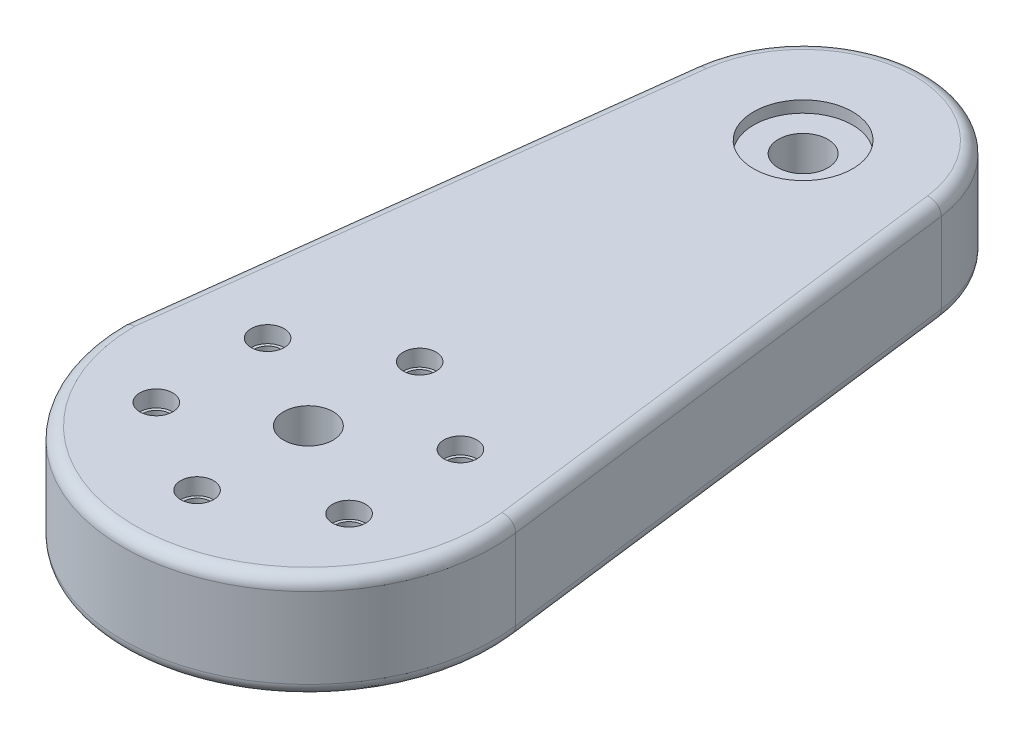
from build123d import *
from OCP.BRepAlgoAPI import BRepAlgoAPI_Cut
from OCP.TopTools import TopTools_ListOfShape

# Parameters (mm, degrees)
EXTRUDE_1_DEPTH                = 4.25
HOLE_WIZARD_M2_1_D             = 1.6
FILLET_1_R                     = 1
SKETCH_5_R                     = 2
CUT_EXTRUDE_1_DEPTH            = 53.889034825
SKETCH_6_R                     = 3
CUT_EXTRUDE_2_DEPTH            = 53.889034825
SCALE_1_SCALE                  = 1.5
SKETCH_7_R                     = 2
CUT_EXTRUDE_3_DEPTH            = 2
PATTERN_START                  = 4.374998274
PATTERN_CIRCULAR_1_OUTLINE_R   = 2
PATTERN_CIRCULAR_1_OUTLINE_R_2 = 1.2
PATTERN_CIRCULAR_1_DEPTH       = 2
SKETCH_10_R                    = 1.65
CUT_EXTRUDE_4_DEPTH            = 10
PATTERN_START_2                = -5.625001726
PATTERN_CIRCULAR_2_OUTLINE_R   = 1.65
PATTERN_CIRCULAR_2_OUTLINE_R_2 = 1.2
PATTERN_CIRCULAR_2_DEPTH       = 10
SKETCH_11_R                    = 1.2
EXTRUDE_2_DEPTH                = 0.75
PATTERN_START_3                = -6.375001726
PATTERN_CIRCULAR_3_OUTLINE_R   = 1.2
PATTERN_CIRCULAR_3_DEPTH       = 0.75
SKETCH_12_R                    = 4.5
SKETCH_12_R_2                  = 3
EXTRUDE_3_DEPTH                = 12.75
CUT_EXTRUDE_START              = -12.75
SKETCH_14_R                    = 6
CUT_EXTRUDE_6_DEPTH            = 1.4


with BuildPart() as part:
    # 草图1 → 凸台-拉伸1 (new, symmetric)
    with BuildSketch(Plane(origin=(0, 0, 0), x_dir=(1, 0, 0), z_dir=(0, 1, 0))):
        with BuildLine():
            ThreePointArc((9.921567416, 41.25), (-0.014158448, 49.999989977), (-9.925067247, 41.221900218))
            Line((-9.925067247, 41.221900218), (-14.552087957, 3.638232549))
            Line((-14.552087957, 3.638232549), (-15, 0))
            ThreePointArc((-15, 0), (0.939343688, -14.970558889), (14.882351125, 1.875))
            Line((14.882351125, 1.875), (9.921567416, 41.25))
        make_face()
    extrude(amount=EXTRUDE_1_DEPTH, both=True)

    # M2 螺纹孔1 (through all)
    with Locations(Plane(origin=(0, 4.25, 0), x_dir=(1, 0, 0), z_dir=(0, 1, 0))):
        with Locations((0, 9), (7.794228634, 4.5), (7.794228634, -4.5), (0, -9), (-7.794228634, -4.5), (-7.794228634, 4.5)):
            Hole(HOLE_WIZARD_M2_1_D / 2)

    # 圆角1
    # the kernel refuses this fillet: 1 mm, written as the material it takes off along each edge
    with BuildSketch(Plane(origin=(0, 4.25, -40), x_dir=(0.9921567416492214, 0, -0.1250000000000007), z_dir=(0.1250000000000007, 0, 0.9921567416492214))) as fillet_1_piece_1:
        with BuildLine():
            CenterArc((10 - FILLET_1_R, -FILLET_1_R), FILLET_1_R, 0, 90)
            Line((10 - FILLET_1_R, 0), (10, 0))
            Line((10, 0), (10, -FILLET_1_R))
        make_face()
    revolve(axis=Axis((0, 4.25, -40), (0, 1, 0)), revolution_arc=165.800732353, mode=Mode.SUBTRACT)
    with BuildSketch(Plane(origin=(-15.519307592, 4.25, 4.21815358), x_dir=(0.9925067247033508, 0, 0.1221900217637565), z_dir=(0.12219002176375648, 0, -0.9925067247033507))) as fillet_1_piece_2:
        with BuildLine():
            CenterArc((FILLET_1_R, FILLET_1_R), FILLET_1_R, 180, 90)
            Line((0, FILLET_1_R), (0, 0))
            Line((0, 0), (FILLET_1_R, 0))
        make_face()
    extrude(amount=45.783119315, mode=Mode.SUBTRACT)
    with BuildSketch(Plane(origin=(0, 4.25, 0), x_dir=(-0.9860951018491775, 0, -0.16618197889380262), z_dir=(0.16618197889380262, 0, -0.9860951018491775))) as fillet_1_piece_3:
        with BuildLine():
            CenterArc((15 - FILLET_1_R, -FILLET_1_R), FILLET_1_R, 0, 90)
            Line((15, -FILLET_1_R), (15, 0))
            Line((15, 0), (15 - FILLET_1_R, 0))
        make_face()
    revolve(axis=Axis((0, 4.25, 0), (0, 1, 0)), revolution_arc=196.746660685, mode=Mode.SUBTRACT)
    with BuildSketch(Plane(origin=(0, -4.25, 0), x_dir=(-0.9860951018491775, 0, -0.16618197889380262), z_dir=(0.16618197889380262, 0, -0.9860951018491775))) as fillet_1_piece_4:
        with BuildLine():
            CenterArc((15 - FILLET_1_R, FILLET_1_R), FILLET_1_R, 270, 90)
            Line((15, FILLET_1_R), (15, 0))
            Line((15, 0), (15 - FILLET_1_R, 0))
        make_face()
    revolve(axis=Axis((0, -4.25, 0), (0, 1, 0)), revolution_arc=196.746660685, mode=Mode.SUBTRACT)
    with BuildSketch(Plane(origin=(14.882351125, 4.25, -1.875), x_dir=(0, -1, 0), z_dir=(-0.12499999999999992, 0, -0.9921567416492215))) as fillet_1_piece_5:
        with BuildLine():
            CenterArc((FILLET_1_R, FILLET_1_R), FILLET_1_R, 180, 90)
            Line((0, FILLET_1_R), (0, 0))
            Line((0, 0), (FILLET_1_R, 0))
        make_face()
    extrude(amount=39.686269666, mode=Mode.SUBTRACT)
    with BuildSketch(Plane(origin=(-15.519307592, -4.25, 4.21815358), x_dir=(0.9925067247033508, 0, 0.1221900217637565), z_dir=(0.12219002176375648, 0, -0.9925067247033507))) as fillet_1_piece_6:
        with BuildLine():
            CenterArc((FILLET_1_R, -FILLET_1_R), FILLET_1_R, 90, 90)
            Line((0, -FILLET_1_R), (0, 0))
            Line((0, 0), (FILLET_1_R, 0))
        make_face()
    extrude(amount=45.783119315, mode=Mode.SUBTRACT)
    with BuildSketch(Plane(origin=(0, -4.25, -40), x_dir=(0.9921567416492214, 0, -0.1250000000000007), z_dir=(0.1250000000000007, 0, 0.9921567416492214))) as fillet_1_piece_7:
        with BuildLine():
            CenterArc((10 - FILLET_1_R, FILLET_1_R), FILLET_1_R, 270, 90)
            Line((10, FILLET_1_R), (10, 0))
            Line((10, 0), (10 - FILLET_1_R, 0))
        make_face()
    revolve(axis=Axis((0, -4.25, -40), (0, 1, 0)), revolution_arc=165.800732353, mode=Mode.SUBTRACT)
    with BuildSketch(Plane(origin=(14.882351125, -4.25, -1.875), x_dir=(0, 1, 0), z_dir=(-0.12499999999999992, 0, -0.9921567416492215))) as fillet_1_piece_8:
        with BuildLine():
            CenterArc((FILLET_1_R, -FILLET_1_R), FILLET_1_R, 90, 90)
            Line((0, -FILLET_1_R), (0, 0))
            Line((0, 0), (FILLET_1_R, 0))
        make_face()
    extrude(amount=39.686269666, mode=Mode.SUBTRACT)

    # 草图5 → 切除-拉伸1 (cut, through all)
    with BuildSketch(Plane(origin=(0, 4.25, 0), x_dir=(1, 0, 0), z_dir=(0, 1, 0))):
        with Locations(Location((0, 40, 0), (0, 0, 270))):
            Circle(SKETCH_5_R)
    extrude(amount=-CUT_EXTRUDE_1_DEPTH, mode=Mode.SUBTRACT)

    # 草图6 → 切除-拉伸2 (cut, through all)
    with BuildSketch(Plane(origin=(0, 4.25, 0), x_dir=(1, 0, 0), z_dir=(0, 1, 0))):
        with Locations(Location((0, 0, 0), (0, 0, 270))):
            Circle(SKETCH_6_R)
    extrude(amount=-CUT_EXTRUDE_2_DEPTH, mode=Mode.SUBTRACT)


with BuildPart() as part_1:
    # 缩放比例1: scaled about (0.021575212, 0, -15.703057272)
    add(part.part.scale(SCALE_1_SCALE).moved(Location((-0.010787606, 0, 7.851528636))))


with BuildPart() as cut_extrude_3_tool:
    # 草图7 → 切除-拉伸3 (new body)
    with BuildSketch(Plane(origin=(0, 6.374998274, 0), x_dir=(1, 0, 0), z_dir=(0, 1, 0))):
        with Locations(Location((-0.010790425, 5.648473397, 0), (0, 0, 270))):
            Circle(SKETCH_7_R)
    extrude(amount=-CUT_EXTRUDE_3_DEPTH)


with BuildPart() as part_2:
    add(part_1.part)

    # 切除-拉伸3: cut by cut_extrude_3_tool, with a tolerance
    cut_extrude_3_stock = TopTools_ListOfShape()
    cut_extrude_3_stock.Append(part_2.part.wrapped)
    cut_extrude_3_tools = TopTools_ListOfShape()
    cut_extrude_3_tools.Append(cut_extrude_3_tool.part.wrapped)
    cut_extrude_3_cut = BRepAlgoAPI_Cut()
    cut_extrude_3_cut.SetArguments(cut_extrude_3_stock)
    cut_extrude_3_cut.SetTools(cut_extrude_3_tools)
    cut_extrude_3_cut.SetFuzzyValue(0.00001)
    cut_extrude_3_cut.Build()
    add(Compound.cast(cut_extrude_3_cut.Shape()).solids(), mode=Mode.REPLACE)


with BuildPart() as pattern_circular_1_tool:
    # 阵列(圆周)1: read off the stored shape, not the designer's step
    # 阵列(圆周)1 outline → 阵列(圆周)1 (new body)
    # profile 1 of 5: a face of its own
    with BuildSketch(Plane(origin=(0, 0, 0), x_dir=(1, 0, 0), z_dir=(0, 1, 0)).offset(PATTERN_START)):
        with Locations((11.680552526, -1.101526603)):
            Circle(PATTERN_CIRCULAR_1_OUTLINE_R)
        with Locations((11.680552526, -1.101526603)):
            Circle(PATTERN_CIRCULAR_1_OUTLINE_R_2, mode=Mode.SUBTRACT)
    # profile 2 of 5: a face of its own
    with BuildSketch(Plane(origin=(0, 0, 0), x_dir=(1, 0, 0), z_dir=(0, 1, 0)).offset(PATTERN_START)):
        with Locations((11.680552526, -14.601526603)):
            Circle(PATTERN_CIRCULAR_1_OUTLINE_R)
        with Locations((11.680552526, -14.601526603)):
            Circle(PATTERN_CIRCULAR_1_OUTLINE_R_2, mode=Mode.SUBTRACT)
    # profile 3 of 5: a face of its own
    with BuildSketch(Plane(origin=(0, 0, 0), x_dir=(1, 0, 0), z_dir=(0, 1, 0)).offset(PATTERN_START)):
        with Locations((-0.010790425, -21.351526603)):
            Circle(PATTERN_CIRCULAR_1_OUTLINE_R)
        with Locations((-0.010790425, -21.351526603)):
            Circle(PATTERN_CIRCULAR_1_OUTLINE_R_2, mode=Mode.SUBTRACT)
    # profile 4 of 5: a face of its own
    with BuildSketch(Plane(origin=(0, 0, 0), x_dir=(1, 0, 0), z_dir=(0, 1, 0)).offset(PATTERN_START)):
        with Locations((-11.702133376, -14.601526603)):
            Circle(PATTERN_CIRCULAR_1_OUTLINE_R)
        with Locations((-11.702133376, -14.601526603)):
            Circle(PATTERN_CIRCULAR_1_OUTLINE_R_2, mode=Mode.SUBTRACT)
    # profile 5 of 5: a face of its own
    with BuildSketch(Plane(origin=(0, 0, 0), x_dir=(1, 0, 0), z_dir=(0, 1, 0)).offset(PATTERN_START)):
        with Locations((-11.702133376, -1.101526603)):
            Circle(PATTERN_CIRCULAR_1_OUTLINE_R)
        with Locations((-11.702133376, -1.101526603)):
            Circle(PATTERN_CIRCULAR_1_OUTLINE_R_2, mode=Mode.SUBTRACT)
    extrude(amount=PATTERN_CIRCULAR_1_DEPTH)


with BuildPart() as part_3:
    add(part_2.part)

    # 阵列(圆周)1: cut by pattern_circular_1_tool, with a tolerance
    pattern_circular_1_stock = TopTools_ListOfShape()
    pattern_circular_1_stock.Append(part_3.part.wrapped)
    pattern_circular_1_tools = TopTools_ListOfShape()
    pattern_circular_1_tools.Append(pattern_circular_1_tool.part.wrapped)
    pattern_circular_1_cut = BRepAlgoAPI_Cut()
    pattern_circular_1_cut.SetArguments(pattern_circular_1_stock)
    pattern_circular_1_cut.SetTools(pattern_circular_1_tools)
    pattern_circular_1_cut.SetFuzzyValue(0.00001)
    pattern_circular_1_cut.Build()
    add(Compound.cast(pattern_circular_1_cut.Shape()).solids(), mode=Mode.REPLACE)

    # 草图10 → 切除-拉伸4 (cut)
    with BuildSketch(Plane(origin=(0, 4.374998274, 0), x_dir=(1, 0, 0), z_dir=(0, 1, 0))):
        with Locations(Location((-0.010790425, 5.648473397, 0), (0, 0, 270))):
            Circle(SKETCH_10_R)
    extrude(amount=-CUT_EXTRUDE_4_DEPTH, mode=Mode.SUBTRACT)


with BuildPart() as pattern_circular_2_tool:
    # 阵列(圆周)2: read off the stored shape, not the designer's step
    # 阵列(圆周)2 outline → 阵列(圆周)2 (new body)
    # profile 1 of 5: a face of its own
    with BuildSketch(Plane(origin=(0, 0, 0), x_dir=(1, 0, 0), z_dir=(0, 1, 0)).offset(PATTERN_START_2)):
        with Locations((-11.702133376, -1.101526603)):
            Circle(PATTERN_CIRCULAR_2_OUTLINE_R)
        with Locations((-11.702133376, -1.101526603)):
            Circle(PATTERN_CIRCULAR_2_OUTLINE_R_2, mode=Mode.SUBTRACT)
    # profile 2 of 5: a face of its own
    with BuildSketch(Plane(origin=(0, 0, 0), x_dir=(1, 0, 0), z_dir=(0, 1, 0)).offset(PATTERN_START_2)):
        with Locations((-11.702133376, -14.601526603)):
            Circle(PATTERN_CIRCULAR_2_OUTLINE_R)
        with Locations((-11.702133376, -14.601526603)):
            Circle(PATTERN_CIRCULAR_2_OUTLINE_R_2, mode=Mode.SUBTRACT)
    # profile 3 of 5: a face of its own
    with BuildSketch(Plane(origin=(0, 0, 0), x_dir=(1, 0, 0), z_dir=(0, 1, 0)).offset(PATTERN_START_2)):
        with Locations((-0.010790425, -21.351526603)):
            Circle(PATTERN_CIRCULAR_2_OUTLINE_R)
        with Locations((-0.010790425, -21.351526603)):
            Circle(PATTERN_CIRCULAR_2_OUTLINE_R_2, mode=Mode.SUBTRACT)
    # profile 4 of 5: a face of its own
    with BuildSketch(Plane(origin=(0, 0, 0), x_dir=(1, 0, 0), z_dir=(0, 1, 0)).offset(PATTERN_START_2)):
        with Locations((11.680552526, -14.601526603)):
            Circle(PATTERN_CIRCULAR_2_OUTLINE_R)
        with Locations((11.680552526, -14.601526603)):
            Circle(PATTERN_CIRCULAR_2_OUTLINE_R_2, mode=Mode.SUBTRACT)
    # profile 5 of 5: a face of its own
    with BuildSketch(Plane(origin=(0, 0, 0), x_dir=(1, 0, 0), z_dir=(0, 1, 0)).offset(PATTERN_START_2)):
        with Locations((11.680552526, -1.101526603)):
            Circle(PATTERN_CIRCULAR_2_OUTLINE_R)
        with Locations((11.680552526, -1.101526603)):
            Circle(PATTERN_CIRCULAR_2_OUTLINE_R_2, mode=Mode.SUBTRACT)
    extrude(amount=PATTERN_CIRCULAR_2_DEPTH)


with BuildPart() as part_4:
    add(part_3.part)

    # 阵列(圆周)2: cut by pattern_circular_2_tool, with a tolerance
    pattern_circular_2_stock = TopTools_ListOfShape()
    pattern_circular_2_stock.Append(part_4.part.wrapped)
    pattern_circular_2_tools = TopTools_ListOfShape()
    pattern_circular_2_tools.Append(pattern_circular_2_tool.part.wrapped)
    pattern_circular_2_cut = BRepAlgoAPI_Cut()
    pattern_circular_2_cut.SetArguments(pattern_circular_2_stock)
    pattern_circular_2_cut.SetTools(pattern_circular_2_tools)
    pattern_circular_2_cut.SetFuzzyValue(0.00001)
    pattern_circular_2_cut.Build()
    add(Compound.cast(pattern_circular_2_cut.Shape()).solids(), mode=Mode.REPLACE)


with BuildPart() as extrude_2_tool:
    # 草图11 → 凸台-拉伸2 (new body)
    with BuildSketch(Plane.XZ.offset(6.375001726)):
        with Locations((-0.010790425, 21.351526603)):
            Circle(SKETCH_11_R)
    extrude(amount=-EXTRUDE_2_DEPTH)


with BuildPart() as part_5:
    add(part_4.part)


with BuildPart() as part_6:
    # 凸台-拉伸2: joined with extrude_2_tool
    add(part_5.part.fuse(extrude_2_tool.part, tol=0.00001))


with BuildPart() as pattern_circular_3_tool:
    # 阵列(圆周)3: read off the stored shape, not the designer's step
    # 阵列(圆周)3 outline → 阵列(圆周)3 (new body)
    with BuildSketch(Plane(origin=(0, 0, 0), x_dir=(1, 0, 0), z_dir=(0, 1, 0)).offset(PATTERN_START_3)):
        with Locations((-11.702133376, -1.101526603)):
            Circle(PATTERN_CIRCULAR_3_OUTLINE_R)
        with Locations((-11.702133376, -14.601526603)):
            Circle(PATTERN_CIRCULAR_3_OUTLINE_R)
        with Locations((11.680552526, -14.601526603)):
            Circle(PATTERN_CIRCULAR_3_OUTLINE_R)
        with Locations((11.680552526, -1.101526603)):
            Circle(PATTERN_CIRCULAR_3_OUTLINE_R)
        with Locations((-0.010790425, 5.648473397)):
            Circle(PATTERN_CIRCULAR_3_OUTLINE_R)
    extrude(amount=PATTERN_CIRCULAR_3_DEPTH)


with BuildPart() as part_7:
    add(part_6.part)


with BuildPart() as part_8:
    # 阵列(圆周)3: joined with pattern_circular_3_tool
    add(part_7.part.fuse(pattern_circular_3_tool.part, tol=0.00001))


with BuildPart() as extrude_3_tool:
    # 草图12 → 凸台-拉伸3 (new body)
    with BuildSketch(Plane(origin=(0, 6.374998274, 0), x_dir=(1, 0, 0), z_dir=(0, 1, 0))):
        with Locations((-0.010790425, -7.851526603)):
            Circle(SKETCH_12_R)
        with Locations(Location((-0.010790425, -7.851526603, 0), (0, 0, 270))):
            Circle(SKETCH_12_R_2, mode=Mode.SUBTRACT)
    extrude(amount=-EXTRUDE_3_DEPTH)


with BuildPart() as part_9:
    add(part_8.part)


with BuildPart() as part_10:
    # 凸台-拉伸3: joined with extrude_3_tool
    add(part_9.part.fuse(extrude_3_tool.part, tol=0.00001))


with BuildPart() as cut_extrude_6_tool:
    # 草图14 → 切除-拉伸6 (new body)
    with BuildSketch(Plane.XZ.offset(6.375001726).offset(CUT_EXTRUDE_START)):
        with Locations(Location((-0.010790425, -52.148473397, 0), (0, 0, 90))):
            Circle(SKETCH_14_R)
    extrude(amount=CUT_EXTRUDE_6_DEPTH)


with BuildPart() as part_11:
    add(part_10.part)

    # 切除-拉伸6: cut by cut_extrude_6_tool, with a tolerance
    cut_extrude_6_stock = TopTools_ListOfShape()
    cut_extrude_6_stock.Append(part_11.part.wrapped)
    cut_extrude_6_tools = TopTools_ListOfShape()
    cut_extrude_6_tools.Append(cut_extrude_6_tool.part.wrapped)
    cut_extrude_6_cut = BRepAlgoAPI_Cut()
    cut_extrude_6_cut.SetArguments(cut_extrude_6_stock)
    cut_extrude_6_cut.SetTools(cut_extrude_6_tools)
    cut_extrude_6_cut.SetFuzzyValue(0.00001)
    cut_extrude_6_cut.Build()
    add(Compound.cast(cut_extrude_6_cut.Shape()).solids(), mode=Mode.REPLACE)


solid = part_11.part
